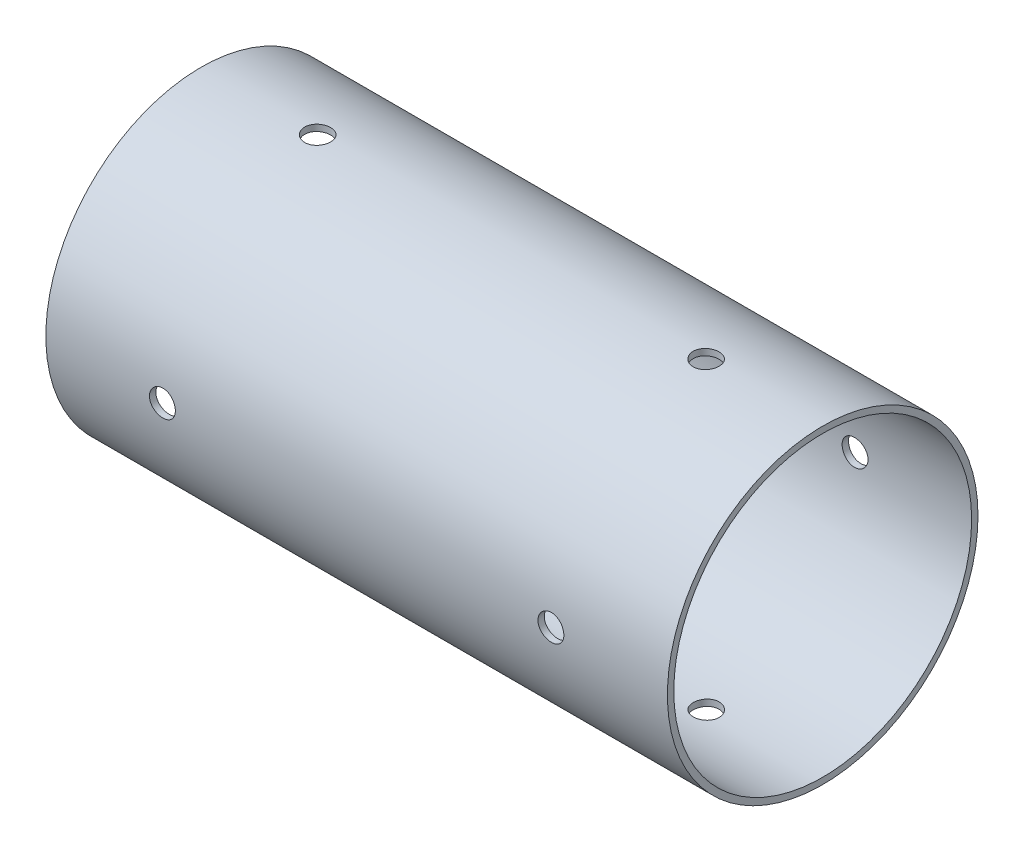
from build123d import *

# Parameters (mm, degrees)
SKETCH1_R           = 38.0746
SKETCH1_R_2         = 36.5125
BOSS_EXTRUDE1_DEPTH = 152.4
SKETCH3_R           = 3.175
CUT_EXTRUDE1_DEPTH  = 162.632640052
CIRPATTERN1_COUNT   = 4
SKETCH4_R           = 3.175
CUT_EXTRUDE2_DEPTH  = 162.632640194
CIRPATTERN2_COUNT   = 4


with BuildPart() as part:
    # Sketch1 → Boss-Extrude1 (new body)
    with BuildSketch(Plane.YZ):
        Circle(SKETCH1_R)
        Circle(SKETCH1_R_2, mode=Mode.SUBTRACT)
    extrude(amount=BOSS_EXTRUDE1_DEPTH)

    # Sketch3 → Cut-Extrude1 (cut, through all)
    with BuildSketch(Plane(origin=(0, 0, 0), x_dir=(-1, 0, 0), z_dir=(0, 1, 0))):
        with Locations((-123.825, 0)):
            Circle(SKETCH3_R)
    cut_extrude1 = extrude(amount=CUT_EXTRUDE1_DEPTH, mode=Mode.SUBTRACT)

    # CirPattern1: Cut-Extrude1 ×4 about axis
    cirpattern1_axis = Axis((152.4, 0, 0), (-1, 0, 0))
    for i in range(1, CIRPATTERN1_COUNT):
        add(cut_extrude1.rotate(cirpattern1_axis, i * 360 / CIRPATTERN1_COUNT), mode=Mode.SUBTRACT)

    # Sketch4 → Cut-Extrude2 (cut, through all)
    with BuildSketch(Plane(origin=(0, 0, 0), x_dir=(-1, 0, 0), z_dir=(0, 1, 0))):
        with Locations((-28.575, 0)):
            Circle(SKETCH4_R)
    cut_extrude2 = extrude(amount=CUT_EXTRUDE2_DEPTH, mode=Mode.SUBTRACT)

    # CirPattern2: Cut-Extrude2 ×4 about axis
    cirpattern2_axis = Axis((152.4, 0, 0), (-1, 0, 0))
    for i in range(1, CIRPATTERN2_COUNT):
        add(cut_extrude2.rotate(cirpattern2_axis, i * 360 / CIRPATTERN2_COUNT), mode=Mode.SUBTRACT)


solid = part.part
